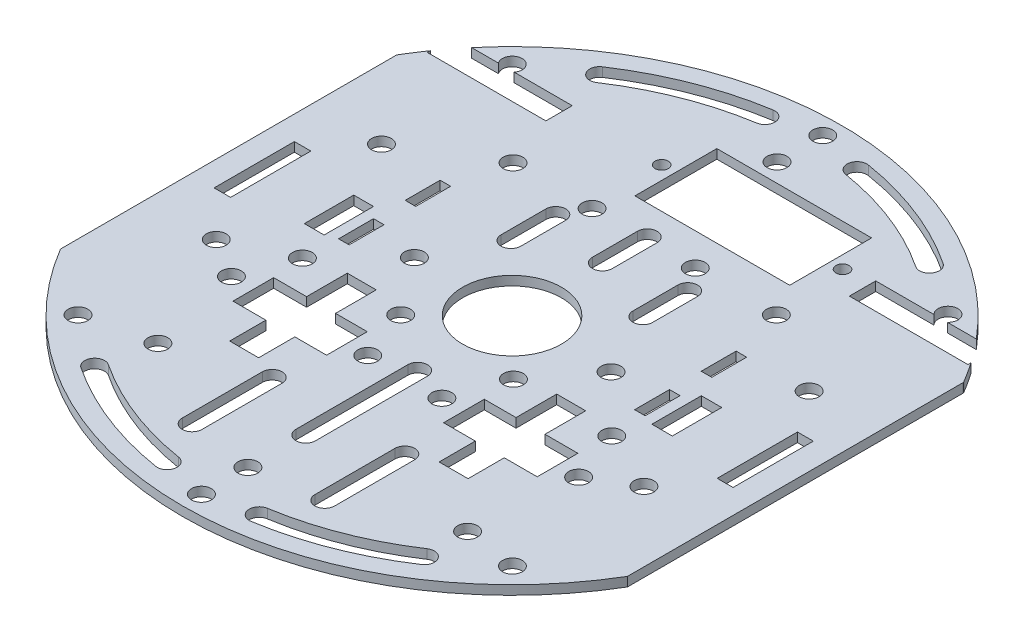
from build123d import *

# Parameters (mm, degrees)
ESQUISSE1_R             = 1.5
ESQUISSE1_W             = 1.6
ESQUISSE1_H             = 5.3
ESQUISSE1_W_2           = 2.5
ESQUISSE1_H_2           = 12.187925894
ESQUISSE1_W_3           = 3
ESQUISSE1_H_3           = 7.5
ESQUISSE1_R_2           = 1
ESQUISSE1_R_3           = 7.5
ESQUISSE1_W_4           = 3.09879963
ESQUISSE1_W_5           = 2.408451493
ESQUISSE1_W_6           = 23.501125708
ESQUISSE1_H_4           = 12.442637558
BOSS_EXTRU_1_DEPTH      = 1.4
ESQUISSE2_W             = 18
ESQUISSE2_H             = 4
ENL_V_MAT_EXTRU_1_DEPTH = 10


with BuildPart() as part:
    # Esquisse1 → Boss.-Extru.1 (new body)
    with BuildSketch(Plane(origin=(0, 0, 0), x_dir=(1, 0, 0), z_dir=(0, 1, 0))):
        with BuildLine():
            Line((35.834434648, 167.520022271), (35.834434648, 116.483137771))
            ThreePointArc((35.834434648, 116.483137771), (78.874434648, 91.965268258), (121.914434648, 116.483137771))
            Line((121.914434648, 116.483137771), (121.914434648, 116.551281317))
            Line((121.914434648, 116.551281317), (121.914434648, 167.451878725))
            ThreePointArc((121.914434648, 167.451878725), (121.905555919, 167.517672727), (121.879554918, 167.578759801))
            ThreePointArc((121.879554918, 167.578759801), (78.840278049, 192.037880126), (35.834434648, 167.520022271))
        make_face()
        with Locations((45.826639299, 109.150380711)):
            Circle(ESQUISSE1_R, mode=Mode.SUBTRACT)
        with Locations((55.638558291, 111.468388624)):
            Circle(ESQUISSE1_R, mode=Mode.SUBTRACT)
        with BuildLine():
            ThreePointArc((71.647029759, 95.137737644), (61.941305066, 97.781552096), (53.012507585, 102.414847058))
            ThreePointArc((53.012507585, 102.414847058), (52.590292227, 104.493725167), (54.669170336, 104.915940525))
            ThreePointArc((54.669170336, 104.915940525), (63.032596319, 100.576025821), (72.123754479, 98.099617713))
            ThreePointArc((72.123754479, 98.099617713), (73.366332154, 96.380315319), (71.647029759, 95.137737644))
        make_face(mode=Mode.SUBTRACT)
        with Locations((78.779387596, 94.934167737)):
            Circle(ESQUISSE1_R, mode=Mode.SUBTRACT)
        with Locations((78.779387596, 101.991662508)):
            Circle(ESQUISSE1_R, mode=Mode.SUBTRACT)
        with BuildLine():
            ThreePointArc((67.298661598, 115.661128867), (68.798661598, 117.161128867), (70.298661598, 115.661128867))
            Line((70.298661598, 115.661128867), (70.298661598, 103.507050761))
            ThreePointArc((70.298661598, 103.507050761), (68.798661598, 102.007050761), (67.298661598, 103.507050761))
            Line((67.298661598, 103.507050761), (67.298661598, 115.661128867))
        make_face(mode=Mode.SUBTRACT)
        with Locations((52.421601233, 125.843457604)):
            Circle(ESQUISSE1_R, mode=Mode.SUBTRACT)
        with Locations((46.409268342, 129.560473998)):
            Circle(ESQUISSE1_R, mode=Mode.SUBTRACT)
        with Locations((55.393988642, 133.652108861)):
            Circle(ESQUISSE1_R, mode=Mode.SUBTRACT)
        with Locations((56.403512098, 141.588703433)):
            Rectangle(ESQUISSE1_W, ESQUISSE1_H, mode=Mode.SUBTRACT)
        Polygon((55.777306889, 122.723571348), (55.777306889, 128.903170923), (60.777306889, 128.903170923), (60.777306889, 135.08096829), (65.174368531, 135.08096829), (65.174368531, 128.903170923), (69.992497573, 128.903170923), (69.992497573, 122.723571348), (65.174368531, 122.723571348), (65.174368531, 117.226495279), (60.777306889, 117.226495279), (60.777306889, 122.723571348), align=None, mode=Mode.SUBTRACT)
        with Locations((73.158157676, 125.813371136)):
            Circle(ESQUISSE1_R, mode=Mode.SUBTRACT)
        with Locations((70.317992081, 133.652108861)):
            Circle(ESQUISSE1_R, mode=Mode.SUBTRACT)
        with BuildLine():
            ThreePointArc((103.079698961, 104.915940525), (105.158577069, 104.493725167), (104.736361712, 102.414847058))
            ThreePointArc((104.736361712, 102.414847058), (95.80756423, 97.781552096), (86.101839537, 95.137737644))
            ThreePointArc((86.101839537, 95.137737644), (84.382537143, 96.380315319), (85.625114817, 98.099617713))
            ThreePointArc((85.625114817, 98.099617713), (94.716272977, 100.576025821), (103.079698961, 104.915940525))
        make_face(mode=Mode.SUBTRACT)
        with BuildLine():
            Line((87.432291643, 103.507050761), (87.432291643, 115.661128867))
            ThreePointArc((87.432291643, 115.661128867), (88.932291643, 117.161128867), (90.432291643, 115.661128867))
            Line((90.432291643, 115.661128867), (90.432291643, 103.507050761))
            ThreePointArc((90.432291643, 103.507050761), (88.932291643, 102.007050761), (87.432291643, 103.507050761))
        make_face(mode=Mode.SUBTRACT)
        with Locations((103.866070776, 110.258751266)):
            Circle(ESQUISSE1_R, mode=Mode.SUBTRACT)
        with Locations((111.829584697, 109.103509138)):
            Circle(ESQUISSE1_R, mode=Mode.SUBTRACT)
        with BuildLine():
            ThreePointArc((77.407537365, 127.639089221), (78.907537365, 129.139089221), (80.407537365, 127.639089221))
            Line((80.407537365, 127.639089221), (80.407537365, 110.639089221))
            ThreePointArc((80.407537365, 110.639089221), (78.907537365, 109.139089221), (77.407537365, 110.639089221))
            Line((77.407537365, 110.639089221), (77.407537365, 127.639089221))
        make_face(mode=Mode.SUBTRACT)
        with Locations((84.410371198, 125.813371136)):
            Circle(ESQUISSE1_R, mode=Mode.SUBTRACT)
        Polygon((92.574500765, 135.08096829), (96.971562407, 135.08096829), (96.971562407, 128.903170923), (101.971562407, 128.903170923), (101.971562407, 122.723571348), (96.971562407, 122.723571348), (96.971562407, 117.226495279), (92.574500765, 117.226495279), (92.574500765, 122.723571348), (87.756371724, 122.723571348), (87.756371724, 128.903170923), (92.574500765, 128.903170923), align=None, mode=Mode.SUBTRACT)
        with Locations((87.32715946, 133.757209253)):
            Circle(ESQUISSE1_R, mode=Mode.SUBTRACT)
        with Locations((105.167621672, 125.813371136)):
            Circle(ESQUISSE1_R, mode=Mode.SUBTRACT)
        with Locations((102.25609839, 133.757209253)):
            Circle(ESQUISSE1_R, mode=Mode.SUBTRACT)
        Polygon((102.145357199, 138.938703433), (100.545408567, 138.938687926), (100.545357199, 144.238687926), (102.145357199, 144.238703433), align=None, mode=Mode.SUBTRACT)
        with Locations((111.339600955, 129.560473998)):
            Circle(ESQUISSE1_R, mode=Mode.SUBTRACT)
        with Locations((40.707988868, 142.276611974)):
            Rectangle(ESQUISSE1_W_2, ESQUISSE1_H_2, mode=Mode.SUBTRACT)
        with Locations((52.502940431, 142.090510183)):
            Rectangle(ESQUISSE1_W_3, ESQUISSE1_H_3, mode=Mode.SUBTRACT)
        with Locations((56.403512098, 151.701300531)):
            Rectangle(ESQUISSE1_W, ESQUISSE1_H, mode=Mode.SUBTRACT)
        with Locations((46.409268342, 154.641573871)):
            Circle(ESQUISSE1_R, mode=Mode.SUBTRACT)
        with Locations((63.821984803, 142.221597832)):
            Circle(ESQUISSE1_R, mode=Mode.SUBTRACT)
        with Locations((58.859299527, 162.163285155)):
            Circle(ESQUISSE1_R, mode=Mode.SUBTRACT)
        with BuildLine():
            ThreePointArc((67.405550143, 158.615345539), (68.905550143, 160.115345539), (70.405550143, 158.615345539))
            Line((70.405550143, 158.615345539), (70.405550143, 151.80054615))
            ThreePointArc((70.405550143, 151.80054615), (68.905550143, 150.30054615), (67.405550143, 151.80054615))
            Line((67.405550143, 151.80054615), (67.405550143, 158.615345539))
        make_face(mode=Mode.SUBTRACT)
        with BuildLine():
            ThreePointArc((77.294154599, 162.614914575), (78.794154599, 164.114914575), (80.294154599, 162.614914575))
            Line((80.294154599, 162.614914575), (80.294154599, 155.800115186))
            ThreePointArc((80.294154599, 155.800115186), (78.794154599, 154.300115186), (77.294154599, 155.800115186))
            Line((77.294154599, 155.800115186), (77.294154599, 162.614914575))
        make_face(mode=Mode.SUBTRACT)
        with Locations((70.864412562, 162.163285155)):
            Circle(ESQUISSE1_R, mode=Mode.SUBTRACT)
        with Locations((45.826639299, 175.080590631)):
            Circle(ESQUISSE1_R, mode=Mode.SUBTRACT)
        with Locations((70.405550143, 173.185321498)):
            Circle(ESQUISSE1_R_2, mode=Mode.SUBTRACT)
        with BuildLine():
            ThreePointArc((54.669170336, 179.087219517), (52.590292227, 179.509434875), (53.012507585, 181.588312984))
            ThreePointArc((53.012507585, 181.588312984), (61.941305066, 186.221607946), (71.647029759, 188.865422397))
            ThreePointArc((71.647029759, 188.865422397), (73.366332154, 187.622844723), (72.123754479, 185.903542329))
            ThreePointArc((72.123754479, 185.903542329), (63.032596319, 183.427134221), (54.669170336, 179.087219517))
        make_face(mode=Mode.SUBTRACT)
        with Locations((78.779387596, 182.324270154)):
            Circle(ESQUISSE1_R, mode=Mode.SUBTRACT)
        with Locations((78.779387596, 189.265840996)):
            Circle(ESQUISSE1_R, mode=Mode.SUBTRACT)
        with Locations((78.874434648, 142.001580021)):
            Circle(ESQUISSE1_R_3, mode=Mode.SUBTRACT)
        with Locations((93.783075314, 142.123577455)):
            Circle(ESQUISSE1_R, mode=Mode.SUBTRACT)
        with BuildLine():
            Line((87.432291643, 151.80054615), (87.432291643, 158.615345539))
            ThreePointArc((87.432291643, 158.615345539), (88.932291643, 160.115345539), (90.432291643, 158.615345539))
            Line((90.432291643, 158.615345539), (90.432291643, 151.80054615))
            ThreePointArc((90.432291643, 151.80054615), (88.932291643, 150.30054615), (87.432291643, 151.80054615))
        make_face(mode=Mode.SUBTRACT)
        with Locations((86.533099498, 162.163285155)):
            Circle(ESQUISSE1_R, mode=Mode.SUBTRACT)
        with Locations((98.837943517, 162.163285155)):
            Circle(ESQUISSE1_R, mode=Mode.SUBTRACT)
        with Locations((105.316670961, 142.090510183)):
            Rectangle(ESQUISSE1_W_4, ESQUISSE1_H_3, mode=Mode.SUBTRACT)
        Polygon((102.145357199, 149.055077174), (100.545310556, 149.05129834), (100.545259188, 154.351313005), (102.145357199, 154.355091961), align=None, mode=Mode.SUBTRACT)
        with Locations((117.040821997, 142.276611974)):
            Rectangle(ESQUISSE1_W_5, ESQUISSE1_H_2, mode=Mode.SUBTRACT)
        with Locations((111.339600955, 154.641573871)):
            Circle(ESQUISSE1_R, mode=Mode.SUBTRACT)
        with Locations((84.201914375, 173.296740459)):
            Rectangle(ESQUISSE1_W_6, ESQUISSE1_H_4, mode=Mode.SUBTRACT)
        with Locations((97.864345109, 173.185321498)):
            Circle(ESQUISSE1_R_2, mode=Mode.SUBTRACT)
        with BuildLine():
            ThreePointArc((86.101839537, 188.865422397), (95.80756423, 186.221607946), (104.736361712, 181.588312984))
            ThreePointArc((104.736361712, 181.588312984), (105.158577069, 179.509434875), (103.079698961, 179.087219517))
            ThreePointArc((103.079698961, 179.087219517), (94.716272977, 183.427134221), (85.625114817, 185.903542329))
            ThreePointArc((85.625114817, 185.903542329), (84.382537143, 187.622844723), (86.101839537, 188.865422397))
        make_face(mode=Mode.SUBTRACT)
        with Locations((111.789066553, 175.276830964)):
            Circle(ESQUISSE1_R, mode=Mode.SUBTRACT)
    extrude(amount=BOSS_EXTRU_1_DEPTH)

    # Esquisse2 → Enlèv. mat.-Extru.1 (cut)
    with BuildSketch(Plane(origin=(0, 0, 0), x_dir=(-1, 0, 0), z_dir=(0, -1, 0))):
        with Locations((-110.914434648, 172.178759801)):
            Rectangle(ESQUISSE2_W, ESQUISSE2_H)
        with Locations((-46.834434648, 172.178759801)):
            Rectangle(ESQUISSE2_W, ESQUISSE2_H)
    extrude(amount=-ENL_V_MAT_EXTRU_1_DEPTH, mode=Mode.SUBTRACT)


solid = part.part
